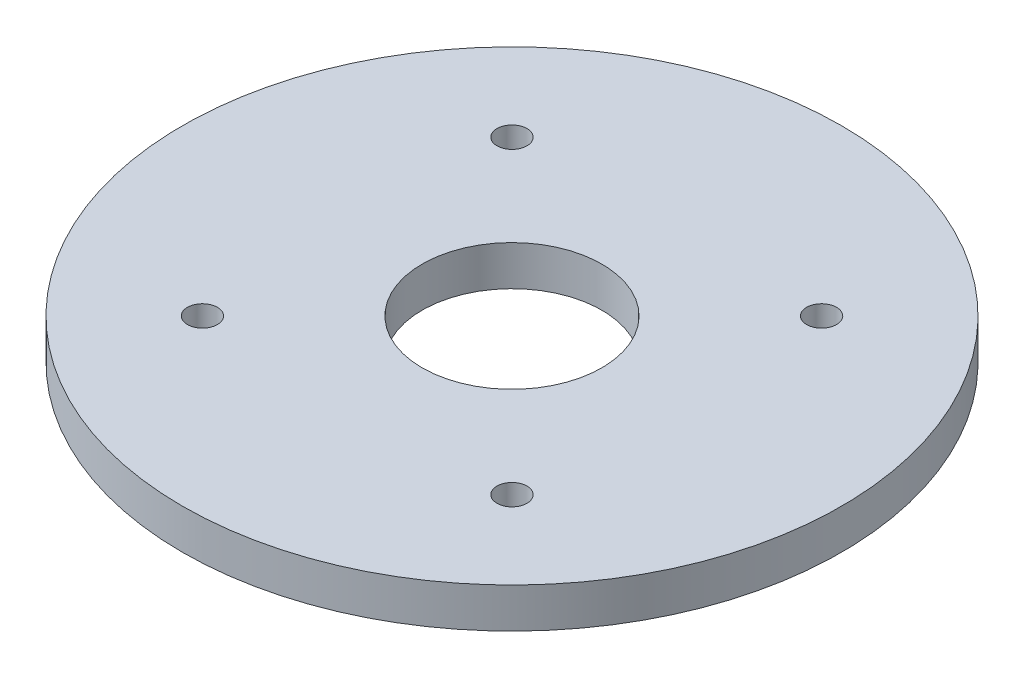
from build123d import *

# Parameters (mm, degrees)
SKETCH1_R           = 33
SKETCH1_R_2         = 1.5
SKETCH1_R_3         = 9
BOSS_EXTRUDE1_DEPTH = 4


with BuildPart() as part:
    # Sketch1 → Boss-Extrude1 (new body)
    with BuildSketch(Plane(origin=(0, 0, 0), x_dir=(1, 0, 0), z_dir=(0, 1, 0))):
        Circle(SKETCH1_R)
        with Locations((15.5, 15.5)):
            Circle(SKETCH1_R_2, mode=Mode.SUBTRACT)
        with Locations((15.5, -15.5)):
            Circle(SKETCH1_R_2, mode=Mode.SUBTRACT)
        with Locations((-15.5, -15.5)):
            Circle(SKETCH1_R_2, mode=Mode.SUBTRACT)
        with Locations((-15.5, 15.5)):
            Circle(SKETCH1_R_2, mode=Mode.SUBTRACT)
        Circle(SKETCH1_R_3, mode=Mode.SUBTRACT)
    extrude(amount=BOSS_EXTRUDE1_DEPTH)


solid = part.part
